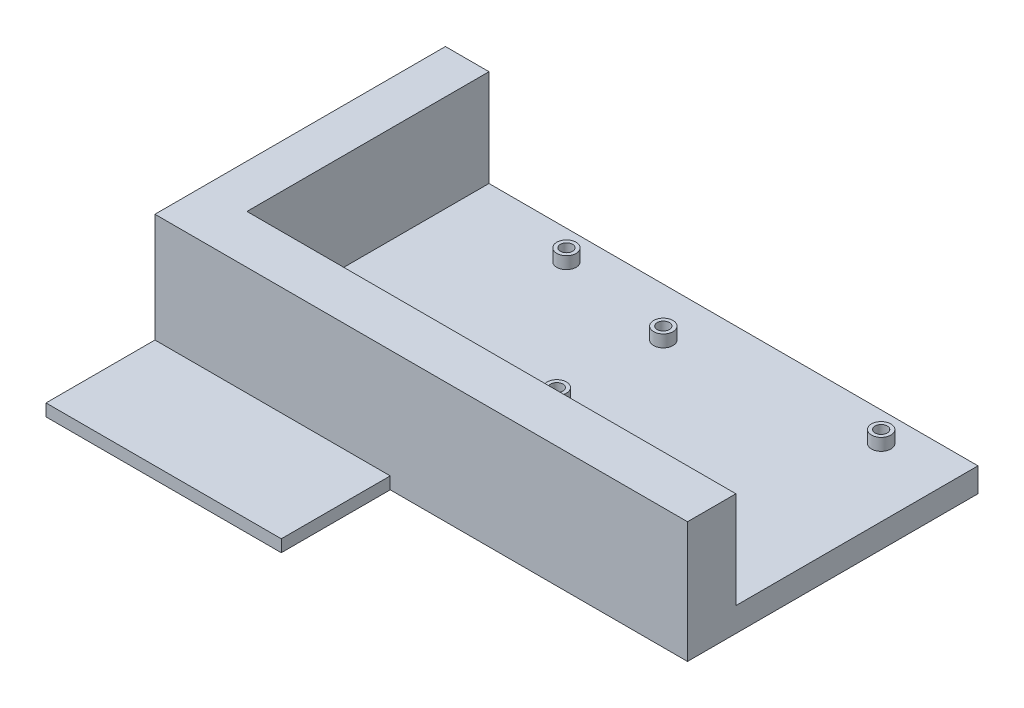
from build123d import *

# Parameters (mm, degrees)
SKETCH1_W           = 139.7
SKETCH1_H           = 76.2
BOSS_EXTRUDE1_DEPTH = 31.75
SKETCH2_W           = 128.27
SKETCH2_H           = 63.545947231
CUT_EXTRUDE1_DEPTH  = 25.4
SKETCH3_W           = 10.16
SKETCH3_H           = 10.16
BOSS_EXTRUDE3_DEPTH = 12.7
SKETCH4_R           = 2.032
CUT_EXTRUDE2_DEPTH  = 82.814026915
SKETCH5_R           = 3.937
CUT_EXTRUDE3_DEPTH  = 2.286
SKETCH6_W           = 61.722
SKETCH6_H           = 3.175
BOSS_EXTRUDE4_DEPTH = 28.575
SKETCH7_R           = 2.54
SKETCH7_R_2         = 1.6002
BOSS_EXTRUDE5_DEPTH = 3.175


with BuildPart() as part:
    # Sketch1 → Boss-Extrude1 (new body)
    with BuildSketch(Plane(origin=(0, 0, 0), x_dir=(1, 0, 0), z_dir=(0, 1, 0))):
        Rectangle(SKETCH1_W, SKETCH1_H)
    extrude(amount=BOSS_EXTRUDE1_DEPTH)

    # Sketch2 → Cut-Extrude1 (cut)
    with BuildSketch(Plane(origin=(0, 31.75, 0), x_dir=(1, 0, 0), z_dir=(0, 1, 0))):
        with Locations((5.715, 6.372973615)):
            Rectangle(SKETCH2_W, SKETCH2_H)
    extrude(amount=-CUT_EXTRUDE1_DEPTH, mode=Mode.SUBTRACT)

    # Sketch3 → Boss-Extrude3 (add)
    with BuildSketch(Plane(origin=(0, 6.35, 0), x_dir=(1, 0, 0), z_dir=(0, 1, 0))):
        with Locations((-53.34, -20.32)):
            Rectangle(SKETCH3_W, SKETCH3_H)
    extrude(amount=BOSS_EXTRUDE3_DEPTH)

    # Sketch4 → Cut-Extrude2 (cut, through all)
    with BuildSketch(Plane(origin=(0, 19.05, 0), x_dir=(1, 0, 0), z_dir=(0, 1, 0))):
        with Locations((-53.34, -20.32)):
            Circle(SKETCH4_R)
    extrude(amount=-CUT_EXTRUDE2_DEPTH, mode=Mode.SUBTRACT)

    # Sketch5 → Cut-Extrude3 (cut)
    with BuildSketch(Plane(origin=(0, 19.05, 0), x_dir=(1, 0, 0), z_dir=(0, 1, 0))):
        with Locations((-53.34, -20.32)):
            Circle(SKETCH5_R)
    extrude(amount=-CUT_EXTRUDE3_DEPTH, mode=Mode.SUBTRACT)

    # Sketch6 → Boss-Extrude4 (add)
    with BuildSketch(Plane.XY.offset(38.1)):
        with Locations((-38.989, 1.5875)):
            Rectangle(SKETCH6_W, SKETCH6_H)
    extrude(amount=BOSS_EXTRUDE4_DEPTH)

    # Sketch7 → Boss-Extrude5 (add)
    # profile 1 of 6: a face of its own
    with BuildSketch(Plane(origin=(0, 6.35, 0), x_dir=(1, 0, 0), z_dir=(0, 1, 0))):
        with Locations((-30.48, 30.48)):
            Circle(SKETCH7_R)
        with Locations((-30.48, 30.48)):
            Circle(SKETCH7_R_2, mode=Mode.SUBTRACT)
    # profile 2 of 6: a face of its own
    with BuildSketch(Plane(origin=(0, 6.35, 0), x_dir=(1, 0, 0), z_dir=(0, 1, 0))):
        with Locations((-24.13, -17.78)):
            Circle(SKETCH7_R)
        with Locations((-24.13, -17.78)):
            Circle(SKETCH7_R_2, mode=Mode.SUBTRACT)
    # profile 3 of 6: a face of its own
    with BuildSketch(Plane(origin=(0, 6.35, 0), x_dir=(1, 0, 0), z_dir=(0, 1, 0))):
        with Locations((0, 25.4)):
            Circle(SKETCH7_R)
        with Locations((0, 25.4)):
            Circle(SKETCH7_R_2, mode=Mode.SUBTRACT)
    # profile 4 of 6: a face of its own
    with BuildSketch(Plane(origin=(0, 6.35, 0), x_dir=(1, 0, 0), z_dir=(0, 1, 0))):
        with Locations((0, -2.54)):
            Circle(SKETCH7_R)
        with Locations((0, -2.54)):
            Circle(SKETCH7_R_2, mode=Mode.SUBTRACT)
    # profile 5 of 6: a face of its own
    with BuildSketch(Plane(origin=(0, 6.35, 0), x_dir=(1, 0, 0), z_dir=(0, 1, 0))):
        with Locations((50.8, -17.78)):
            Circle(SKETCH7_R)
        with Locations((50.8, -17.78)):
            Circle(SKETCH7_R_2, mode=Mode.SUBTRACT)
    # profile 6 of 6: a face of its own
    with BuildSketch(Plane(origin=(0, 6.35, 0), x_dir=(1, 0, 0), z_dir=(0, 1, 0))):
        with Locations((52.07, 30.48)):
            Circle(SKETCH7_R)
        with Locations((52.07, 30.48)):
            Circle(SKETCH7_R_2, mode=Mode.SUBTRACT)
    extrude(amount=BOSS_EXTRUDE5_DEPTH)


solid = part.part
